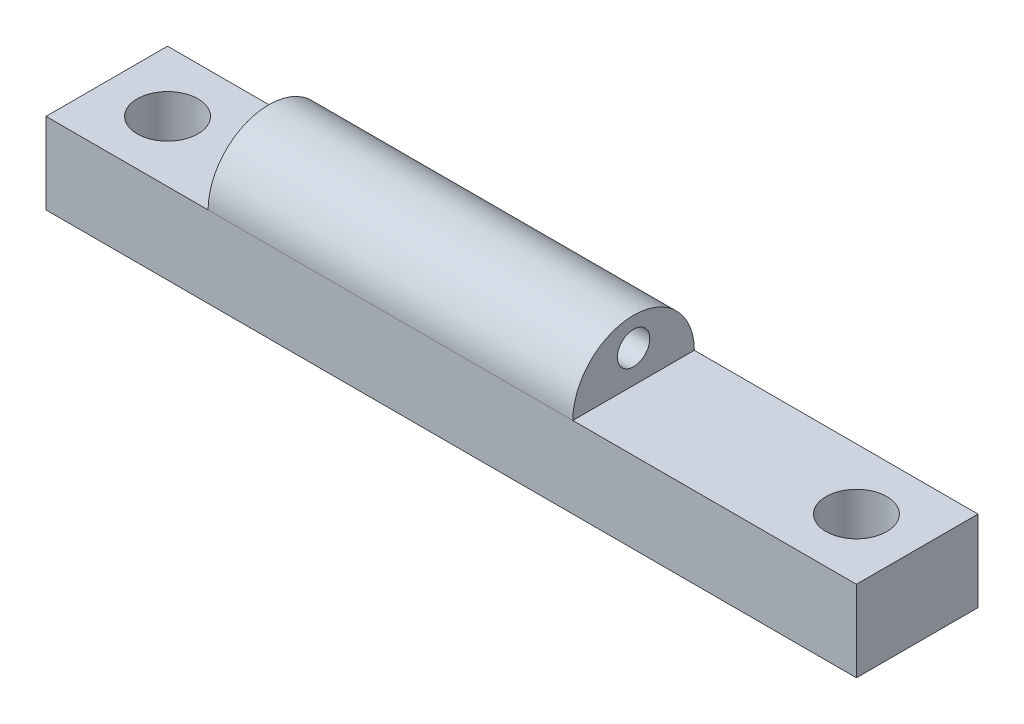
from build123d import *

# Parameters (mm, degrees)
SKETCH1_W           = 50.8
SKETCH1_H           = 7.62
BOSS_EXTRUDE1_DEPTH = 5.08
BOSS_EXTRUDE2_START = -17.78
SKETCH2_R           = 1.016
BOSS_EXTRUDE2_DEPTH = 22.86
SKETCH3_R           = 1.905
CUT_EXTRUDE1_DEPTH  = 27.181720723


with BuildPart() as part:
    # Sketch1 → Boss-Extrude1 (new body)
    with BuildSketch(Plane(origin=(0, 0, 0), x_dir=(1, 0, 0), z_dir=(0, 1, 0))):
        Rectangle(SKETCH1_W, SKETCH1_H)
    extrude(amount=BOSS_EXTRUDE1_DEPTH)

    # Sketch3 → Cut-Extrude1 (cut, through all)
    with BuildSketch(Plane(origin=(0, 5.08, 0), x_dir=(1, 0, 0), z_dir=(0, 1, 0))):
        with Locations((-21.59, 0)):
            Circle(SKETCH3_R)
        with Locations((21.59, 0)):
            Circle(SKETCH3_R)
    extrude(amount=-CUT_EXTRUDE1_DEPTH, mode=Mode.SUBTRACT)


with BuildPart() as body_2:
    # Sketch2 → Boss-Extrude2 (new body)
    with BuildSketch(Plane(origin=(25.4, 0, 0), x_dir=(0, 0, -1), z_dir=(1, 0, 0)).offset(BOSS_EXTRUDE2_START)):
        with BuildLine():
            Line((3.81, 5.08), (-3.81, 5.08))
            ThreePointArc((-3.81, 5.08), (0, 8.89), (3.81, 5.08))
        make_face()
        with Locations((0, 7.112)):
            Circle(SKETCH2_R, mode=Mode.SUBTRACT)
    extrude(amount=-BOSS_EXTRUDE2_DEPTH)


solid = Compound([part.part, body_2.part])
